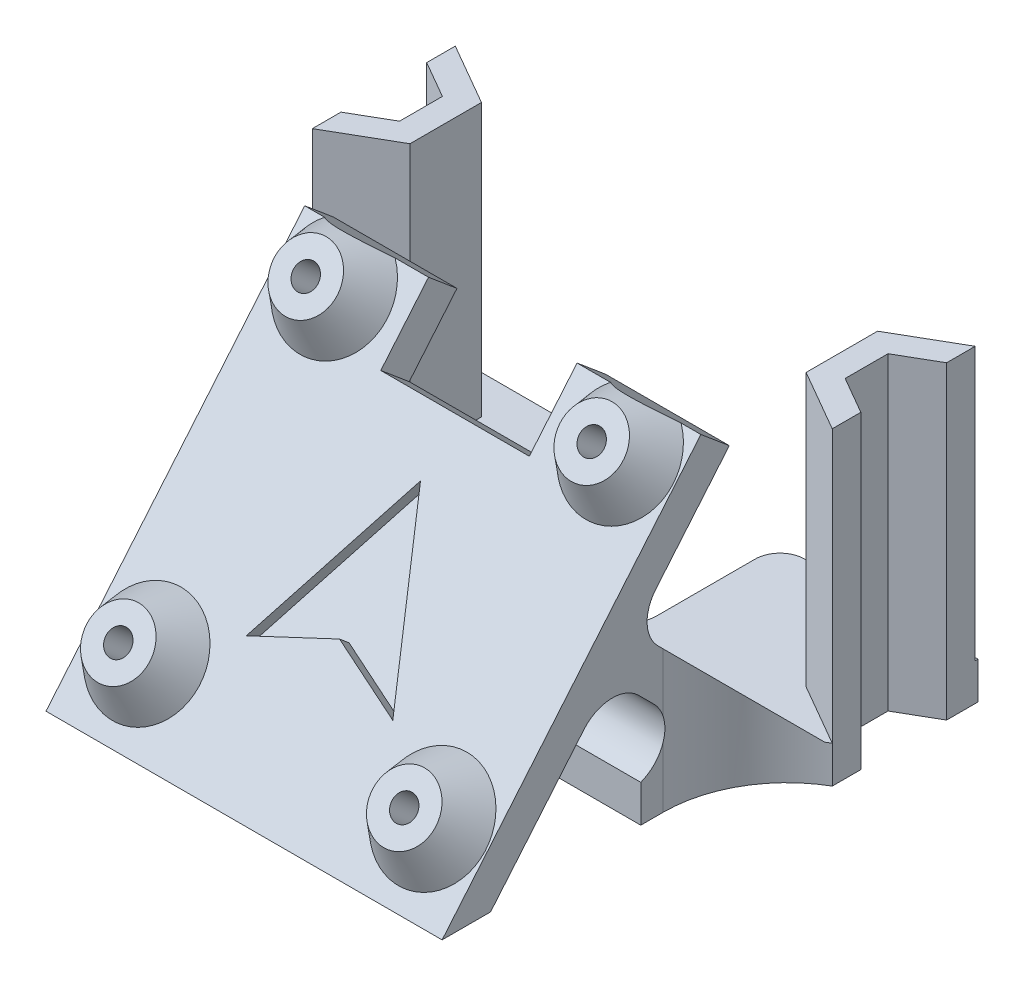
from build123d import *

# Parameters (mm, degrees)
EXTRUDE_1_DEPTH     = 50
CUT_EXTRUDE_1_DEPTH = 67.680295137
EXTRUDE_2_DEPTH     = 22
SKETCH_6_W          = 5
SKETCH_6_H          = 38.291343347
CUT_EXTRUDE_5_DEPTH = 50
SKETCH_8_R          = 2.5
SKETCH_8_R_2        = 1
EXTRUDE_4_DEPTH     = 3
CHAMFER_1_SIZE      = 1.8
CHAMFER_1_SIZE_2    = 3.117691454
SKETCH_9_W          = 10
SKETCH_9_H          = 12
CUT_EXTRUDE_6_DEPTH = 3
SKETCH_10_W         = 12
SKETCH_10_H         = 6
CUT_EXTRUDE_7_DEPTH = 3
FILLET_2_R          = 3
FILLET_3_R          = 3
FILLET_4_R          = 3
CUT_EXTRUDE_8_DEPTH = 1
FILLET_7_R          = 2
SKETCH_12_W         = 5
SKETCH_12_H         = 26.517840655
CUT_EXTRUDE_9_DEPTH = 66.543850106
FILLET_8_R          = 10


with BuildPart() as part:
    # Эскиз2 → Бобышка-Вытянуть1 (new body)
    with BuildSketch(Plane(origin=(0, 0, 0), x_dir=(0, 0, -1), z_dir=(1, 0, 0))):
        Polygon((0, 0), (-22.242640687, 0), (-22.242640687, 3), (-16.242640687, 3), (-24.733307334, 11.490666647), (-34.375121479, 0), (-38.291343347, 0), (-17.389626518, 24.909696123), (-15.091493189, 22.981333294), (-22.797578472, 13.797578472), (-12, 3), (0, 3), align=None)
    extrude(amount=EXTRUDE_1_DEPTH)

    # Эскиз3 → Вырез-Вытянуть1 (cut, through all)
    with BuildSketch(Plane(origin=(0, 3, 0), x_dir=(1, 0, 0), z_dir=(0, 1, 0))):
        Polygon((4, -2.535898385), (1, -4.267949192), (1, -7.732050808), (4, -9.464101615), (7, -7.732050808), (7, -4.267949192), align=None)
        Polygon((46, -2.535898385), (43, -4.267949192), (43, -7.732050808), (46, -9.464101615), (49, -7.732050808), (49, -4.267949192), align=None)
    extrude(amount=-CUT_EXTRUDE_1_DEPTH, mode=Mode.SUBTRACT)

    # Эскиз5 → Бобышка-Вытянуть2 (add)
    # profile 1 of 2: a face of its own
    with BuildSketch(Plane(origin=(0, 3, 0), x_dir=(1, 0, 0), z_dir=(0, 1, 0))):
        Polygon((4, -0.226497308), (-1, -3.113248654), (-1, -8.886751346), (4, -11.773502692), (9, -8.886751346), (9, -3.113248654), align=None)
        Polygon((4, -2.535898385), (1, -4.267949192), (1, -7.732050808), (4, -9.464101615), (7, -7.732050808), (7, -4.267949192), align=None, mode=Mode.SUBTRACT)
    # profile 2 of 2: a face of its own
    with BuildSketch(Plane(origin=(0, 3, 0), x_dir=(1, 0, 0), z_dir=(0, 1, 0))):
        Polygon((46, -0.226497308), (41, -3.113248654), (41, -8.886751346), (46, -11.773502692), (51, -8.886751346), (51, -3.113248654), align=None)
        Polygon((46, -2.535898385), (43, -4.267949192), (43, -7.732050808), (46, -9.464101615), (49, -7.732050808), (49, -4.267949192), align=None, mode=Mode.SUBTRACT)
    extrude(amount=EXTRUDE_2_DEPTH)

    # Эскиз6 → Вырез-Вытянуть5 (cut)
    with BuildSketch(Plane.XZ):
        with Locations((48.5, 19.145671674)):
            Rectangle(SKETCH_6_W, SKETCH_6_H)
        with Locations((1.5, 19.145671674)):
            Rectangle(SKETCH_6_W, SKETCH_6_H)
    extrude(amount=-CUT_EXTRUDE_5_DEPTH, mode=Mode.SUBTRACT)

    # Эскиз8 → Бобышка-Вытянуть4 (add)
    # profile 1 of 4: a face of its own
    with BuildSketch(Plane(origin=(0, 18.854805901, 22.47028267), x_dir=(1, 0, 0), z_dir=(0, 0.6427876096865299, 0.766044443118986))):
        with Locations(Location((36.55, 4.684097832, 0), (0, 0, 90))):
            Circle(SKETCH_8_R)
        with Locations(Location((36.55, 4.684097832, 0), (0, 0, 270))):
            Circle(SKETCH_8_R_2, mode=Mode.SUBTRACT)
    # profile 2 of 4: a face of its own
    with BuildSketch(Plane(origin=(0, 18.854805901, 22.47028267), x_dir=(1, 0, 0), z_dir=(0, 0.6427876096865299, 0.766044443118986))):
        with Locations(Location((13.45, 4.684097832, 0), (0, 0, 90))):
            Circle(SKETCH_8_R)
        with Locations(Location((13.45, 4.684097832, 0), (0, 0, 270))):
            Circle(SKETCH_8_R_2, mode=Mode.SUBTRACT)
    # profile 3 of 4: a face of its own
    with BuildSketch(Plane(origin=(0, 18.854805901, 22.47028267), x_dir=(1, 0, 0), z_dir=(0, 0.6427876096865299, 0.766044443118986))):
        with Locations(Location((13.45, -18.875902168, 0), (0, 0, 90))):
            Circle(SKETCH_8_R)
        with Locations(Location((13.45, -18.875902168, 0), (0, 0, 270))):
            Circle(SKETCH_8_R_2, mode=Mode.SUBTRACT)
    # profile 4 of 4: a face of its own
    with BuildSketch(Plane(origin=(0, 18.854805901, 22.47028267), x_dir=(1, 0, 0), z_dir=(0, 0.6427876096865299, 0.766044443118986))):
        with Locations(Location((36.55, -18.875902168, 0), (0, 0, 90))):
            Circle(SKETCH_8_R)
        with Locations(Location((36.55, -18.875902168, 0), (0, 0, 270))):
            Circle(SKETCH_8_R_2, mode=Mode.SUBTRACT)
    extrude(amount=EXTRUDE_4_DEPTH)

    # Фаска1
    # the kernel refuses this chamfer: 3.117691454, 1.8 mm, written as the material it adds along each edge
    with BuildSketch(Plane(origin=(36.55, 4.395025936, 34.603478705), x_dir=(0, 0.7660444431189859, -0.6427876096865299), z_dir=(1, 0, 0))) as chamfer_1_piece_1_section:
        Polygon((2.5 + CHAMFER_1_SIZE, 0), (2.5, CHAMFER_1_SIZE_2), (2.5, 0), align=None)
    chamfer_1_piece_1 = revolve(axis=Axis((36.55, 4.395025936, 34.603478705), (0, 0.6427876096865299, 0.766044443118986)), mode=Mode.PRIVATE)
    chamfer_1_piece_1 = split(chamfer_1_piece_1, bisect_by=Plane(origin=(36.55, 3.695067891, 39.107035111), z_dir=(0, -0.6427876096865299, -0.766044443118986)), keep=Keep.TOP, mode=Mode.PRIVATE)
    add(chamfer_1_piece_1)
    with BuildSketch(Plane(origin=(13.45, 4.395025936, 34.603478705), x_dir=(0, 0.7660444431189862, -0.6427876096865297), z_dir=(1, 0, 0))) as chamfer_1_piece_2_section:
        Polygon((2.5 + CHAMFER_1_SIZE, 0), (2.5, CHAMFER_1_SIZE_2), (2.5, 0), align=None)
    chamfer_1_piece_2 = revolve(axis=Axis((13.45, 4.395025936, 34.603478705), (0, 0.6427876096865299, 0.766044443118986)), mode=Mode.PRIVATE)
    chamfer_1_piece_2 = split(chamfer_1_piece_2, bisect_by=Plane(origin=(13.45, 3.695067891, 39.107035111), z_dir=(0, -0.6427876096865299, -0.766044443118986)), keep=Keep.TOP, mode=Mode.PRIVATE)
    add(chamfer_1_piece_2)
    with BuildSketch(Plane(origin=(36.55, 22.443033016, 19.459402621), x_dir=(0, 0.7660444431189869, -0.6427876096865287), z_dir=(1, 0, 0))) as chamfer_1_piece_3_section:
        Polygon((2.5 + CHAMFER_1_SIZE, 0), (2.5, CHAMFER_1_SIZE_2), (2.5, 0), align=None)
    chamfer_1_piece_3 = revolve(axis=Axis((36.55, 22.443033016, 19.459402621), (0, 0.6427876096865299, 0.766044443118986)), mode=Mode.PRIVATE)
    chamfer_1_piece_3 = split(chamfer_1_piece_3, bisect_by=Plane(origin=(36.55, 25.826754315, 18.482533914), z_dir=(0, -0.7660444431189845, 0.6427876096865317)), keep=Keep.TOP, mode=Mode.PRIVATE)
    chamfer_1_piece_3 = split(chamfer_1_piece_3, bisect_by=Plane(origin=(36.55, 21.742557786, 23.963392996), z_dir=(0, -0.6427876096865299, -0.766044443118986)), keep=Keep.TOP, mode=Mode.PRIVATE)
    add(chamfer_1_piece_3)
    with BuildSketch(Plane(origin=(13.45, 22.443033016, 19.459402621), x_dir=(0, 0.7660444431189863, -0.6427876096865293), z_dir=(1, 0, 0))) as chamfer_1_piece_4_section:
        Polygon((2.5 + CHAMFER_1_SIZE, 0), (2.5, CHAMFER_1_SIZE_2), (2.5, 0), align=None)
    chamfer_1_piece_4 = revolve(axis=Axis((13.45, 22.443033016, 19.459402621), (0, 0.6427876096865299, 0.766044443118986)), mode=Mode.PRIVATE)
    chamfer_1_piece_4 = split(chamfer_1_piece_4, bisect_by=Plane(origin=(13.45, 25.826754315, 18.482533914), z_dir=(0, -0.7660444431189845, 0.6427876096865317)), keep=Keep.TOP, mode=Mode.PRIVATE)
    chamfer_1_piece_4 = split(chamfer_1_piece_4, bisect_by=Plane(origin=(13.45, 21.742557786, 23.963392996), z_dir=(0, -0.6427876096865299, -0.766044443118986)), keep=Keep.TOP, mode=Mode.PRIVATE)
    add(chamfer_1_piece_4)

    # Эскиз9 → Вырез-Вытянуть6 (cut)
    with BuildSketch(Plane(origin=(0, 3, 0), x_dir=(1, 0, 0), z_dir=(0, 1, 0))):
        with Locations((25, -6)):
            Rectangle(SKETCH_9_W, SKETCH_9_H)
    extrude(amount=-CUT_EXTRUDE_6_DEPTH, mode=Mode.SUBTRACT)

    # Эскиз10 → Вырез-Вытянуть7 (cut)
    with BuildSketch(Plane(origin=(0, 18.854805901, 22.47028267), x_dir=(1, 0, 0), z_dir=(0, 0.6427876096865299, 0.766044443118986))):
        with Locations((25, 4.904097832)):
            Rectangle(SKETCH_10_W, SKETCH_10_H)
    extrude(amount=-CUT_EXTRUDE_7_DEPTH, mode=Mode.SUBTRACT)

    # Скругление2
    fillet_2_edges = [part.edges().sort_by_distance(p)[0] for p in [
        (25, 11.490666647, 24.733307334),
    ]]
    fillet(fillet_2_edges, radius=FILLET_2_R)

    # Скругление3
    # the kernel refuses this fillet: 3 mm, written as the material it adds along each edge
    with BuildSketch(Plane(origin=(4, 3, 16.242640687), x_dir=(0, 0.7071067811865437, 0.7071067811865515), z_dir=(1, 0, 0))) as fillet_3_piece_1:
        with BuildLine():
            CenterArc((6.97317985, 3), FILLET_3_R, 155.530199479, 114.469800521)
            Line((4.242640687, 4.242640687), (4.188029904, 4.267493501))
            ThreePointArc((4.188029904, 4.267493501), (2.078893937, 2.16374675), (-0.042426407, 0.042426407))
            Line((-0.042426407, 0.042426407), (0, -0.06))
            Line((0, -0.06), (6.97317985, -0.06))
            Line((6.97317985, -0.06), (6.97317985, 0))
        make_face()
    extrude(amount=42)

    # Скругление4
    fillet_4_edges = [part.edges().sort_by_distance(p)[0] for p in [
        (25, 13.797578472, 22.797578472),
    ]]
    fillet(fillet_4_edges, radius=FILLET_4_R)

    # Эскиз11 → Вырез-Вытянуть8 (cut)
    with BuildSketch(Plane(origin=(0, 18.854805901, 22.47028267), x_dir=(1, 0, 0), z_dir=(0, 0.6427876096865303, 0.7660444431189857))):
        Polygon((25, -2.436363369), (19.083344336, -15.124672388), (25, -12.613201062), (30.916655664, -15.124672388), align=None)
    extrude(amount=-CUT_EXTRUDE_8_DEPTH, mode=Mode.SUBTRACT)

    # Скругление7
    fillet_7_edges = [part.edges().sort_by_distance(p)[0] for p in [
        (30, 1.5, 0),
        (30, 1.5, 12),
        (20, 1.5, 12),
        (20, 1.5, 0),
    ]]
    fillet(fillet_7_edges, radius=FILLET_7_R)

    # Эскиз12 → Вырез-Вытянуть9 (cut, through all)
    with BuildSketch(Plane.XZ):
        with Locations((6.5, 25.03242302)):
            Rectangle(SKETCH_12_W, SKETCH_12_H)
        with Locations((43.5, 25.03242302)):
            Rectangle(SKETCH_12_W, SKETCH_12_H)
    extrude(amount=-CUT_EXTRUDE_9_DEPTH, mode=Mode.SUBTRACT)

    # Скругление8
    # the kernel refuses this fillet: 10 mm, written as the material it adds along each edge
    with BuildSketch(Plane(origin=(41, 0, 11.773502692), x_dir=(0, 0, 1), z_dir=(0, 1, 0))) as fillet_8_piece_1:
        with BuildLine():
            CenterArc((8.660254038, 10), FILLET_8_R, 210, 60)
            Line((0, 5), (0, 0))
            Line((0, 0), (8.660254038, 0))
        make_face()
    extrude(amount=3)
    with BuildSketch(Plane(origin=(41, 0, 11.773502692), x_dir=(0, 0, 1), z_dir=(0, 1, 0))) as fillet_8_piece_2_section:
        with BuildLine():
            CenterArc((8.660254038, 10), FILLET_8_R, 210, 60)
            Line((0, 5), (0, 0))
            Line((0, 0), (8.660254038, 0))
        make_face()
    fillet_8_piece_2 = extrude(amount=24.650635095, mode=Mode.PRIVATE)
    fillet_8_piece_2 = split(fillet_8_piece_2, bisect_by=Plane(origin=(41.119825884, 8.491267272, 17.491267272), z_dir=(0, -0.7071067811865512, 0.7071067811865439)), keep=Keep.TOP, mode=Mode.PRIVATE)
    fillet_8_piece_2 = fillet_8_piece_2 - Plane(origin=(41.119825884, 5.809462415, 23.294743789), x_dir=(0, 0.7071067811865476, 0.7071067811865476), z_dir=(-1, 0, 0)) * Cylinder(3, 84, mode=Mode.PRIVATE)
    add(fillet_8_piece_2)
    with BuildSketch(Plane(origin=(9, 0, 11.773502692), x_dir=(0, 0, 1), z_dir=(0, 1, 0))) as fillet_8_piece_3:
        with BuildLine():
            CenterArc((8.660254038, -10), FILLET_8_R, 90, 60)
            Line((0, -5), (0, 0))
            Line((0, 0), (8.660254038, 0))
        make_face()
    extrude(amount=3)
    with BuildSketch(Plane(origin=(9, 0, 11.773502692), x_dir=(0, 0, 1), z_dir=(0, 1, 0))) as fillet_8_piece_4_section:
        with BuildLine():
            CenterArc((8.660254038, -10), FILLET_8_R, 90, 60)
            Line((0, -5), (0, 0))
            Line((0, 0), (8.660254038, 0))
        make_face()
    fillet_8_piece_4 = extrude(amount=24.650635095, mode=Mode.PRIVATE)
    fillet_8_piece_4 = split(fillet_8_piece_4, bisect_by=Plane(origin=(8.880174116, 8.491267272, 17.491267272), z_dir=(0, -0.7071067811865512, 0.7071067811865439)), keep=Keep.TOP, mode=Mode.PRIVATE)
    fillet_8_piece_4 = fillet_8_piece_4 - Plane(origin=(8.880174116, 5.809462415, 23.294743789), x_dir=(0, 0.7071067811865476, 0.7071067811865476), z_dir=(-1, 0, 0)) * Cylinder(3, 84, mode=Mode.PRIVATE)
    add(fillet_8_piece_4)


solid = part.part
